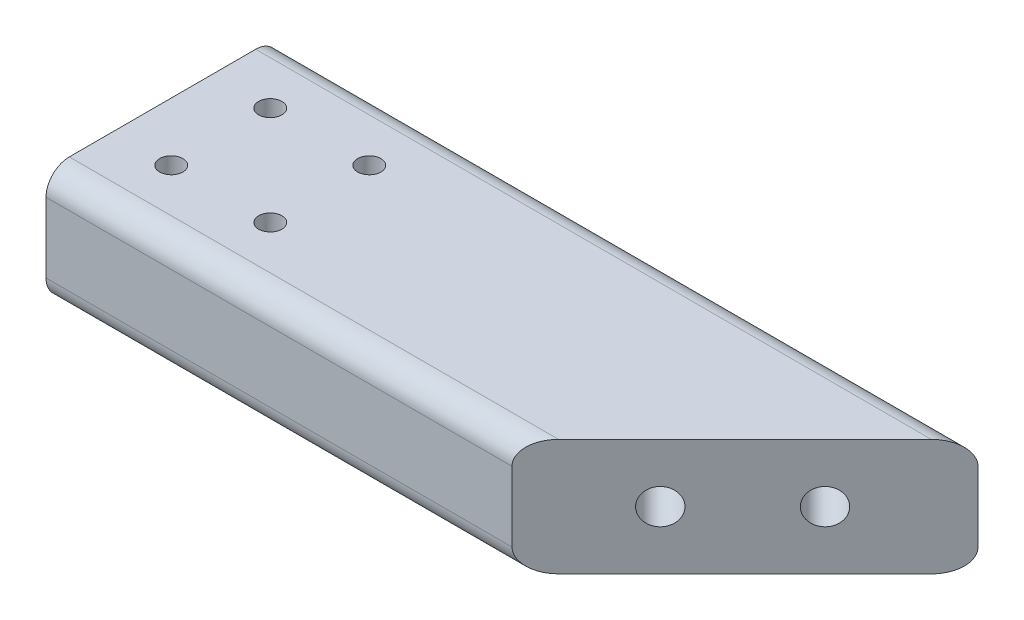
from build123d import *

# Parameters (mm, degrees)
SKETCH1_W           = 60
SKETCH1_H           = 20
BOSS_EXTRUDE1_DEPTH = 10
SKETCH2_R           = 1
CUT_EXTRUDE1_DEPTH  = 10
CUT_EXTRUDE4_DEPTH  = 34.166247904
SKETCH6_R           = 1.5
CUT_EXTRUDE5_DEPTH  = 46.82575695
CUT_EXTRUDE6_START  = -5
SKETCH7_R           = 3.5
CUT_EXTRUDE6_DEPTH  = 41.82575695
FILLET2_R           = 2


with BuildPart() as part:
    # Sketch1 → Boss-Extrude1 (new body)
    with BuildSketch(Plane(origin=(0, 0, 0), x_dir=(1, 0, 0), z_dir=(0, 1, 0))):
        Rectangle(SKETCH1_W, SKETCH1_H)
    extrude(amount=BOSS_EXTRUDE1_DEPTH)

    # Sketch2 → Cut-Extrude1 (cut)
    with BuildSketch(Plane(origin=(0, 10, 0), x_dir=(1, 0, 0), z_dir=(0, 1, 0))):
        with Locations(Location((-25, 4.25, 0), (0, 0, 270))):
            Circle(SKETCH2_R)
        with Locations(Location((-16.5, 4.25, 0), (0, 0, 270))):
            Circle(SKETCH2_R)
        with Locations(Location((-16.5, -4.25, 0), (0, 0, 270))):
            Circle(SKETCH2_R)
        with Locations(Location((-25, -4.25, 0), (0, 0, 270))):
            Circle(SKETCH2_R)
    extrude(amount=-CUT_EXTRUDE1_DEPTH, mode=Mode.SUBTRACT)

    # Sketch5 → Cut-Extrude4 (cut, through all)
    with BuildSketch(Plane(origin=(0, 10, 0), x_dir=(1, 0, 0), z_dir=(0, 1, 0))):
        Polygon((10, -10), (30, 10), (30, -10), align=None)
    extrude(amount=-CUT_EXTRUDE4_DEPTH, mode=Mode.SUBTRACT)

    # Sketch6 → Cut-Extrude5 (cut, through all)
    with BuildSketch(Plane(origin=(10, 0, 10), x_dir=(0.7071067811865487, 0, -0.7071067811865464), z_dir=(0.7071067811865464, 0, 0.7071067811865487))):
        with Locations((19, 5)):
            Circle(SKETCH6_R)
        with Locations((9, 5)):
            Circle(SKETCH6_R)
    extrude(amount=-CUT_EXTRUDE5_DEPTH, mode=Mode.SUBTRACT)

    # Sketch7 → Cut-Extrude6 (cut, through all)
    with BuildSketch(Plane(origin=(10, 0, 10), x_dir=(0.7071067811865487, 0, -0.7071067811865464), z_dir=(0.7071067811865464, 0, 0.7071067811865487)).offset(CUT_EXTRUDE6_START)):
        with Locations((19, 5)):
            Circle(SKETCH7_R)
        with Locations((9, 5)):
            Circle(SKETCH7_R)
    extrude(amount=-CUT_EXTRUDE6_DEPTH, mode=Mode.SUBTRACT)

    # Fillet2
    # the kernel refuses this fillet: 2 mm, written as the material it takes off along each edge
    with BuildSketch(Plane(origin=(15, 10, 10), x_dir=(0, -1, 0), z_dir=(-1, 0, 0))) as fillet2_piece_1:
        with BuildLine():
            CenterArc((FILLET2_R, -FILLET2_R), FILLET2_R, 90, 90)
            Line((0, -FILLET2_R), (0, 0))
            Line((0, 0), (FILLET2_R, 0))
        make_face()
    extrude(amount=50, mode=Mode.SUBTRACT)
    with BuildSketch(Plane(origin=(15, 0, 10), x_dir=(0, 1, 0), z_dir=(-1, 0, 0))) as fillet2_piece_2:
        with BuildLine():
            CenterArc((FILLET2_R, FILLET2_R), FILLET2_R, 180, 90)
            Line((0, FILLET2_R), (0, 0))
            Line((0, 0), (FILLET2_R, 0))
        make_face()
    extrude(amount=50, mode=Mode.SUBTRACT)
    with BuildSketch(Plane(origin=(-35, 0, -10), x_dir=(0, 0, 1), z_dir=(1, 0, 0))) as fillet2_piece_3:
        with BuildLine():
            CenterArc((FILLET2_R, -FILLET2_R), FILLET2_R, 90, 90)
            Line((0, -FILLET2_R), (0, 0))
            Line((0, 0), (FILLET2_R, 0))
        make_face()
    extrude(amount=70, mode=Mode.SUBTRACT)
    with BuildSketch(Plane(origin=(-35, 10, -10), x_dir=(0, 0, 1), z_dir=(1, 0, 0))) as fillet2_piece_4:
        with BuildLine():
            CenterArc((FILLET2_R, FILLET2_R), FILLET2_R, 180, 90)
            Line((0, FILLET2_R), (0, 0))
            Line((0, 0), (FILLET2_R, 0))
        make_face()
    extrude(amount=70, mode=Mode.SUBTRACT)


solid = part.part
